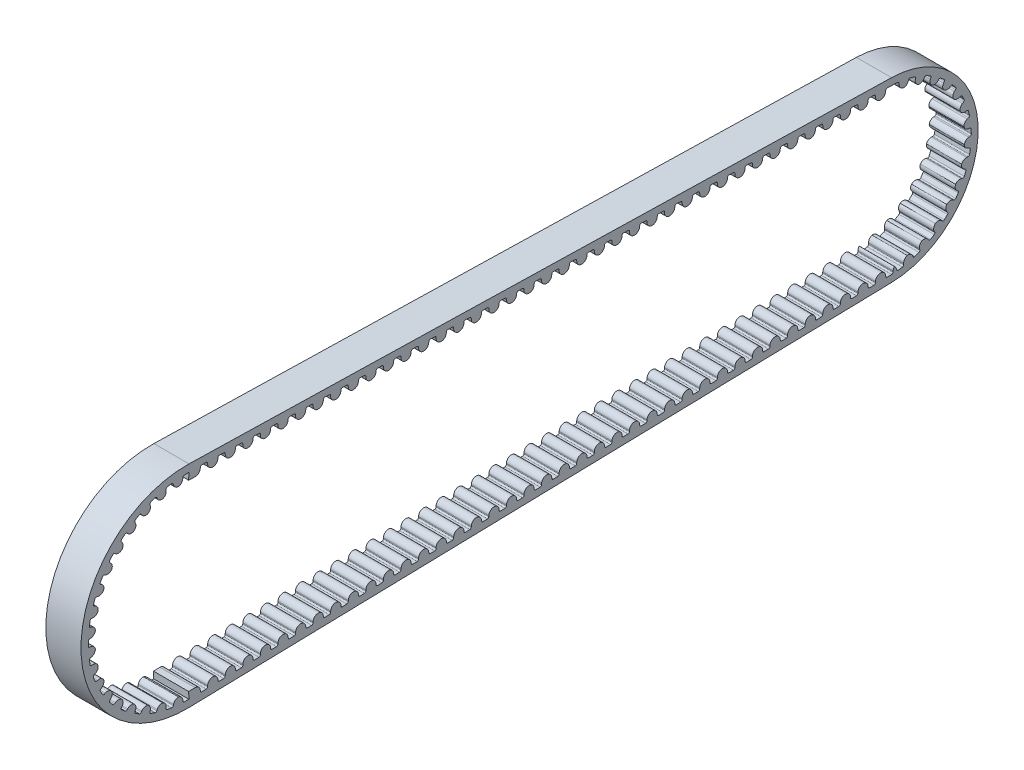
from build123d import *

# Parameters (mm, degrees)
SKETCH_2_W               = 6
SKETCH_2_H               = 2.4
CUT_EXTRUDE_1_DEPTH      = 137.430989504
PATTERN_CIRCULAR_1_COUNT = 36
CUT_EXTRUDE_2_DEPTH      = 137.430989504
PATTERN_CIRCULAR_2_COUNT = 30
SKETCH_11_W              = 6
SKETCH_11_H              = 119.925782778
EXTRUDE_11_DEPTH         = 2.4
CUT_EXTRUDE_3_REACH      = 138.431
PATTERN_LINEAR_1_COUNT   = 40
PATTERN_LINEAR_1_PITCH   = 3
MIRROR_1_COPY_1_REACH    = 138.431
MIRROR_1_COPY_2_REACH    = 138.431
MIRROR_1_COPY_3_REACH    = 138.431
MIRROR_1_COPY_4_REACH    = 138.431
MIRROR_1_COPY_5_REACH    = 138.431
MIRROR_1_COPY_6_REACH    = 138.431
MIRROR_1_COPY_7_REACH    = 138.431
MIRROR_1_COPY_8_REACH    = 138.431
MIRROR_1_COPY_9_REACH    = 138.431
MIRROR_1_COPY_10_REACH   = 138.431
MIRROR_1_COPY_11_REACH   = 138.431
MIRROR_1_COPY_12_REACH   = 138.431
MIRROR_1_COPY_13_REACH   = 138.431
MIRROR_1_COPY_14_REACH   = 138.431
MIRROR_1_COPY_15_REACH   = 138.431
MIRROR_1_COPY_16_REACH   = 138.431
MIRROR_1_COPY_17_REACH   = 138.431
MIRROR_1_COPY_18_REACH   = 138.431
MIRROR_1_COPY_19_REACH   = 138.431
MIRROR_1_COPY_20_REACH   = 138.431
MIRROR_1_COPY_21_REACH   = 138.431
MIRROR_1_COPY_22_REACH   = 138.431
MIRROR_1_COPY_23_REACH   = 138.431
MIRROR_1_COPY_24_REACH   = 138.431
MIRROR_1_COPY_25_REACH   = 138.431
MIRROR_1_COPY_26_REACH   = 138.431
MIRROR_1_COPY_27_REACH   = 138.431
MIRROR_1_COPY_28_REACH   = 138.431
MIRROR_1_COPY_29_REACH   = 138.431
MIRROR_1_COPY_30_REACH   = 138.431
MIRROR_1_COPY_31_REACH   = 138.431
MIRROR_1_COPY_32_REACH   = 138.431
MIRROR_1_COPY_33_REACH   = 138.431
MIRROR_1_COPY_34_REACH   = 138.431
MIRROR_1_COPY_35_REACH   = 138.431
MIRROR_1_COPY_36_REACH   = 138.431
MIRROR_1_COPY_37_REACH   = 138.431
MIRROR_1_COPY_38_REACH   = 138.431
MIRROR_1_COPY_39_REACH   = 138.431


with BuildPart() as part:
    # 扫描1: sweep along a path in 草图1
    with BuildLine(Plane(origin=(0, 0, 0), x_dir=(0, 0, -1), z_dir=(1, 0, 0))) as sweep_1_path:
        Line((0.430108244, 18.003863138), (120.321683561, 15.139680347))
        ThreePointArc((120.321683561, 15.139680347), (135.104, 0), (120.321683561, -15.139680347))
        Line((120.321683561, -15.139680347), (0.430108244, -18.003863138))
        ThreePointArc((0.430108244, -18.003863138), (-18.009, 0), (0.430108244, 18.003863138))
    # 草图2 → 扫描1 (sweep)
    with BuildSketch(Plane.XY):
        with Locations((0, 16.809)):
            Rectangle(SKETCH_2_W, SKETCH_2_H)
    sweep(path=sweep_1_path.line)

    # 草图3 → 切除-拉伸1 (cut, through all)
    with BuildSketch(Plane(origin=(3, 0, 0), x_dir=(0, 0, -1), z_dir=(1, 0, 0))):
        with BuildLine():
            Line((-16.760589295, -0.382514428), (-16.760589295, 0.382514428))
            ThreePointArc((-16.760589295, 0.382514428), (-16.694775482, 0.547617947), (-16.533429528, 0.622170699))
            Line((-16.533429528, 0.622170699), (-16.36404345, 0.631246016))
            ThreePointArc((-16.36404345, 0.631246016), (-15.779164365, 0.901499743), (-15.540589295, 1.5))
            Line((-15.540589295, 1.5), (-13.1201949, 1.5))
            Line((-13.1201949, 1.5), (-13.1201949, -1.5))
            Line((-13.1201949, -1.5), (-15.540589295, -1.5))
            ThreePointArc((-15.540589295, -1.5), (-15.779164365, -0.901499743), (-16.36404345, -0.631246016))
            Line((-16.36404345, -0.631246016), (-16.533429528, -0.622170699))
            ThreePointArc((-16.533429528, -0.622170699), (-16.694775482, -0.547617947), (-16.760589295, -0.382514428))
        make_face()
    cut_extrude_1 = extrude(amount=-CUT_EXTRUDE_1_DEPTH, mode=Mode.SUBTRACT)

    # 阵列(圆周)1: 切除-拉伸1 ×36 about axis
    pattern_circular_1_axis = Axis((0, 0, 0), (1, 0, 0))
    for i in range(1, PATTERN_CIRCULAR_1_COUNT):
        add(cut_extrude_1.rotate(pattern_circular_1_axis, i * 360 / PATTERN_CIRCULAR_1_COUNT), mode=Mode.SUBTRACT)

    # 草图4 → 切除-拉伸2 (cut, through all)
    with BuildSketch(Plane(origin=(3, 0, 0), x_dir=(0, 0, -1), z_dir=(1, 0, 0))):
        with BuildLine():
            Line((133.907660906, 0.770033285), (133.928868088, 0.030337229))
            ThreePointArc((133.928868088, 0.030337229), (133.872619042, -0.131045806), (133.723241537, -0.214080737))
            Line((133.723241537, -0.214080737), (133.487149373, -0.248146705))
            ThreePointArc((133.487149373, -0.248146705), (132.945655916, -0.549148333), (132.741753125, -1.134161833))
            ThreePointArc((132.741753125, -1.134161833), (132.458141229, -1.80210933), (131.766816708, -2.022699386))
            Line((131.766816708, -2.022699386), (131.74216386, -1.162820187))
            Line((131.74216386, -1.162820187), (131.656188797, 1.835947608))
            Line((131.656188797, 1.835947608), (131.631535949, 2.695826807))
            ThreePointArc((131.631535949, 2.695826807), (132.334363201, 2.515207264), (132.655778062, 1.864605962))
            ThreePointArc((132.655778062, 1.864605962), (132.892863198, 1.292235644), (133.450712533, 1.022752317))
            Line((133.450712533, 1.022752317), (133.688368638, 1.002268773))
            ThreePointArc((133.688368638, 1.002268773), (133.84225811, 0.927928545), (133.907660906, 0.770033285))
        make_face()
    cut_extrude_2 = extrude(amount=-CUT_EXTRUDE_2_DEPTH, mode=Mode.SUBTRACT)

    # 阵列(圆周)2: 切除-拉伸2 ×30 about axis
    pattern_circular_2_axis = Axis((0, 0, -119.96), (1, 0, 0))
    for i in range(1, PATTERN_CIRCULAR_2_COUNT):
        add(cut_extrude_2.rotate(pattern_circular_2_axis, i * 360 / PATTERN_CIRCULAR_2_COUNT), mode=Mode.SUBTRACT)

    # 草图11 → 拉伸11 (add)
    with BuildSketch(Plane(origin=(0, 18.003863138, -0.430108244), x_dir=(1, 0, 0), z_dir=(0, 0.9997147614067193, -0.023882960986995376))):
        with Locations((0, 59.962891389)):
            Rectangle(SKETCH_11_W, SKETCH_11_H)
    extrude_11 = extrude(amount=-EXTRUDE_11_DEPTH)

    # 镜向2: 拉伸11 across plane
    add(extrude_11.mirror(Plane.ZX))

    # 草图5 → 切除-拉伸3 (cut, up to next)
    with BuildSketch(Plane(origin=(3, 0, 0), x_dir=(0, 0, -1), z_dir=(1, 0, 0)), mode=Mode.PRIVATE) as cut_extrude_3_sk1:
        with BuildLine():
            Line((2.608225525, 16.771491728), (3.373036165, 16.753220574))
            ThreePointArc((3.373036165, 16.753220574), (3.536520761, 16.683482373), (3.607198829, 16.5204019))
            Line((3.607198829, 16.5204019), (3.612226117, 16.350847393))
            ThreePointArc((3.612226117, 16.350847393), (3.868434112, 15.759680678), (4.461065775, 15.506879701))
            Line((4.461065775, 15.506879701), (4.413299853, 13.507450178))
            Line((4.413299853, 13.507450178), (1.414155569, 13.579099061))
            Line((1.414155569, 13.579099061), (1.46192149, 15.578528584))
            ThreePointArc((1.46192149, 15.578528584), (2.065948911, 15.802741644), (2.350094196, 16.380999441))
            Line((2.350094196, 16.380999441), (2.363212365, 16.550120457))
            ThreePointArc((2.363212365, 16.550120457), (2.441597271, 16.709639849), (2.608225525, 16.771491728))
        make_face()
    cut_extrude_3_tool1 = extrude(cut_extrude_3_sk1.sketch, amount=-CUT_EXTRUDE_3_REACH, mode=Mode.PRIVATE) & part.part
    cut_extrude_3 = cut_extrude_3_tool1.solids().sort_by_distance((3, 14.90035, -2.946148))[0]
    add(cut_extrude_3, mode=Mode.SUBTRACT)

    # 阵列(线性)1: 切除-拉伸3 ×40
    with Locations(*[Vector(0, -0.02388296098699538, -0.9997147614067193) * (i * PATTERN_LINEAR_1_PITCH) for i in range(1, PATTERN_LINEAR_1_COUNT)]):
        add(cut_extrude_3, mode=Mode.SUBTRACT)

    # 镜向1: 切除-拉伸3 across plane
    add(cut_extrude_3.mirror(Plane.ZX), mode=Mode.SUBTRACT)

    # 镜向1 copy 1 sketch → 镜向1 copy 1 (cut, up to next)
    with BuildSketch(Plane(origin=(3, 0.071648883, -2.999144284), x_dir=(0, 0, -1), z_dir=(1, 0, 0)), mode=Mode.PRIVATE) as mirror_1_copy_1_sk1:
        with BuildLine():
            Line((2.608225525, -16.771491728), (3.373036165, -16.753220574))
            ThreePointArc((3.373036165, -16.753220574), (3.536520761, -16.683482373), (3.607198829, -16.5204019))
            Line((3.607198829, -16.5204019), (3.612226117, -16.350847393))
            ThreePointArc((3.612226117, -16.350847393), (3.868434112, -15.759680678), (4.461065775, -15.506879701))
            Line((4.461065775, -15.506879701), (4.413299853, -13.507450178))
            Line((4.413299853, -13.507450178), (1.414155569, -13.579099061))
            Line((1.414155569, -13.579099061), (1.46192149, -15.578528584))
            ThreePointArc((1.46192149, -15.578528584), (2.065948911, -15.802741644), (2.350094196, -16.380999441))
            Line((2.350094196, -16.380999441), (2.363212365, -16.550120457))
            ThreePointArc((2.363212365, -16.550120457), (2.441597271, -16.709639849), (2.608225525, -16.771491728))
        make_face()
    mirror_1_copy_1_tool1 = extrude(mirror_1_copy_1_sk1.sketch, amount=-MIRROR_1_COPY_1_REACH, mode=Mode.PRIVATE) & part.part
    add(mirror_1_copy_1_tool1.solids().sort_by_distance((3, -14.828701117, -5.945292284))[0], mode=Mode.SUBTRACT)

    # 镜向1 copy 2 sketch → 镜向1 copy 2 (cut, up to next)
    with BuildSketch(Plane(origin=(3, 0.143297766, -5.998288568), x_dir=(0, 0, -1), z_dir=(1, 0, 0)), mode=Mode.PRIVATE) as mirror_1_copy_2_sk1:
        with BuildLine():
            Line((2.608225525, -16.771491728), (3.373036165, -16.753220574))
            ThreePointArc((3.373036165, -16.753220574), (3.536520761, -16.683482373), (3.607198829, -16.5204019))
            Line((3.607198829, -16.5204019), (3.612226117, -16.350847393))
            ThreePointArc((3.612226117, -16.350847393), (3.868434112, -15.759680678), (4.461065775, -15.506879701))
            Line((4.461065775, -15.506879701), (4.413299853, -13.507450178))
            Line((4.413299853, -13.507450178), (1.414155569, -13.579099061))
            Line((1.414155569, -13.579099061), (1.46192149, -15.578528584))
            ThreePointArc((1.46192149, -15.578528584), (2.065948911, -15.802741644), (2.350094196, -16.380999441))
            Line((2.350094196, -16.380999441), (2.363212365, -16.550120457))
            ThreePointArc((2.363212365, -16.550120457), (2.441597271, -16.709639849), (2.608225525, -16.771491728))
        make_face()
    mirror_1_copy_2_tool1 = extrude(mirror_1_copy_2_sk1.sketch, amount=-MIRROR_1_COPY_2_REACH, mode=Mode.PRIVATE) & part.part
    add(mirror_1_copy_2_tool1.solids().sort_by_distance((3, -14.757052234, -8.944436568))[0], mode=Mode.SUBTRACT)

    # 镜向1 copy 3 sketch → 镜向1 copy 3 (cut, up to next)
    with BuildSketch(Plane(origin=(3, 0.214946649, -8.997432853), x_dir=(0, 0, -1), z_dir=(1, 0, 0)), mode=Mode.PRIVATE) as mirror_1_copy_3_sk1:
        with BuildLine():
            Line((2.608225525, -16.771491728), (3.373036165, -16.753220574))
            ThreePointArc((3.373036165, -16.753220574), (3.536520761, -16.683482373), (3.607198829, -16.5204019))
            Line((3.607198829, -16.5204019), (3.612226117, -16.350847393))
            ThreePointArc((3.612226117, -16.350847393), (3.868434112, -15.759680678), (4.461065775, -15.506879701))
            Line((4.461065775, -15.506879701), (4.413299853, -13.507450178))
            Line((4.413299853, -13.507450178), (1.414155569, -13.579099061))
            Line((1.414155569, -13.579099061), (1.46192149, -15.578528584))
            ThreePointArc((1.46192149, -15.578528584), (2.065948911, -15.802741644), (2.350094196, -16.380999441))
            Line((2.350094196, -16.380999441), (2.363212365, -16.550120457))
            ThreePointArc((2.363212365, -16.550120457), (2.441597271, -16.709639849), (2.608225525, -16.771491728))
        make_face()
    mirror_1_copy_3_tool1 = extrude(mirror_1_copy_3_sk1.sketch, amount=-MIRROR_1_COPY_3_REACH, mode=Mode.PRIVATE) & part.part
    add(mirror_1_copy_3_tool1.solids().sort_by_distance((3, -14.685403351, -11.943580853))[0], mode=Mode.SUBTRACT)

    # 镜向1 copy 4 sketch → 镜向1 copy 4 (cut, up to next)
    with BuildSketch(Plane(origin=(3, 0.286595532, -11.996577137), x_dir=(0, 0, -1), z_dir=(1, 0, 0)), mode=Mode.PRIVATE) as mirror_1_copy_4_sk1:
        with BuildLine():
            Line((2.608225525, -16.771491728), (3.373036165, -16.753220574))
            ThreePointArc((3.373036165, -16.753220574), (3.536520761, -16.683482373), (3.607198829, -16.5204019))
            Line((3.607198829, -16.5204019), (3.612226117, -16.350847393))
            ThreePointArc((3.612226117, -16.350847393), (3.868434112, -15.759680678), (4.461065775, -15.506879701))
            Line((4.461065775, -15.506879701), (4.413299853, -13.507450178))
            Line((4.413299853, -13.507450178), (1.414155569, -13.579099061))
            Line((1.414155569, -13.579099061), (1.46192149, -15.578528584))
            ThreePointArc((1.46192149, -15.578528584), (2.065948911, -15.802741644), (2.350094196, -16.380999441))
            Line((2.350094196, -16.380999441), (2.363212365, -16.550120457))
            ThreePointArc((2.363212365, -16.550120457), (2.441597271, -16.709639849), (2.608225525, -16.771491728))
        make_face()
    mirror_1_copy_4_tool1 = extrude(mirror_1_copy_4_sk1.sketch, amount=-MIRROR_1_COPY_4_REACH, mode=Mode.PRIVATE) & part.part
    add(mirror_1_copy_4_tool1.solids().sort_by_distance((3, -14.613754468, -14.942725137))[0], mode=Mode.SUBTRACT)

    # 镜向1 copy 5 sketch → 镜向1 copy 5 (cut, up to next)
    with BuildSketch(Plane(origin=(3, 0.358244415, -14.995721421), x_dir=(0, 0, -1), z_dir=(1, 0, 0)), mode=Mode.PRIVATE) as mirror_1_copy_5_sk1:
        with BuildLine():
            Line((2.608225525, -16.771491728), (3.373036165, -16.753220574))
            ThreePointArc((3.373036165, -16.753220574), (3.536520761, -16.683482373), (3.607198829, -16.5204019))
            Line((3.607198829, -16.5204019), (3.612226117, -16.350847393))
            ThreePointArc((3.612226117, -16.350847393), (3.868434112, -15.759680678), (4.461065775, -15.506879701))
            Line((4.461065775, -15.506879701), (4.413299853, -13.507450178))
            Line((4.413299853, -13.507450178), (1.414155569, -13.579099061))
            Line((1.414155569, -13.579099061), (1.46192149, -15.578528584))
            ThreePointArc((1.46192149, -15.578528584), (2.065948911, -15.802741644), (2.350094196, -16.380999441))
            Line((2.350094196, -16.380999441), (2.363212365, -16.550120457))
            ThreePointArc((2.363212365, -16.550120457), (2.441597271, -16.709639849), (2.608225525, -16.771491728))
        make_face()
    mirror_1_copy_5_tool1 = extrude(mirror_1_copy_5_sk1.sketch, amount=-MIRROR_1_COPY_5_REACH, mode=Mode.PRIVATE) & part.part
    add(mirror_1_copy_5_tool1.solids().sort_by_distance((3, -14.542105585, -17.941869421))[0], mode=Mode.SUBTRACT)

    # 镜向1 copy 6 sketch → 镜向1 copy 6 (cut, up to next)
    with BuildSketch(Plane(origin=(3, 0.429893298, -17.994865705), x_dir=(0, 0, -1), z_dir=(1, 0, 0)), mode=Mode.PRIVATE) as mirror_1_copy_6_sk1:
        with BuildLine():
            Line((2.608225525, -16.771491728), (3.373036165, -16.753220574))
            ThreePointArc((3.373036165, -16.753220574), (3.536520761, -16.683482373), (3.607198829, -16.5204019))
            Line((3.607198829, -16.5204019), (3.612226117, -16.350847393))
            ThreePointArc((3.612226117, -16.350847393), (3.868434112, -15.759680678), (4.461065775, -15.506879701))
            Line((4.461065775, -15.506879701), (4.413299853, -13.507450178))
            Line((4.413299853, -13.507450178), (1.414155569, -13.579099061))
            Line((1.414155569, -13.579099061), (1.46192149, -15.578528584))
            ThreePointArc((1.46192149, -15.578528584), (2.065948911, -15.802741644), (2.350094196, -16.380999441))
            Line((2.350094196, -16.380999441), (2.363212365, -16.550120457))
            ThreePointArc((2.363212365, -16.550120457), (2.441597271, -16.709639849), (2.608225525, -16.771491728))
        make_face()
    mirror_1_copy_6_tool1 = extrude(mirror_1_copy_6_sk1.sketch, amount=-MIRROR_1_COPY_6_REACH, mode=Mode.PRIVATE) & part.part
    add(mirror_1_copy_6_tool1.solids().sort_by_distance((3, -14.470456702, -20.941013705))[0], mode=Mode.SUBTRACT)

    # 镜向1 copy 7 sketch → 镜向1 copy 7 (cut, up to next)
    with BuildSketch(Plane(origin=(3, 0.501542181, -20.99400999), x_dir=(0, 0, -1), z_dir=(1, 0, 0)), mode=Mode.PRIVATE) as mirror_1_copy_7_sk1:
        with BuildLine():
            Line((2.608225525, -16.771491728), (3.373036165, -16.753220574))
            ThreePointArc((3.373036165, -16.753220574), (3.536520761, -16.683482373), (3.607198829, -16.5204019))
            Line((3.607198829, -16.5204019), (3.612226117, -16.350847393))
            ThreePointArc((3.612226117, -16.350847393), (3.868434112, -15.759680678), (4.461065775, -15.506879701))
            Line((4.461065775, -15.506879701), (4.413299853, -13.507450178))
            Line((4.413299853, -13.507450178), (1.414155569, -13.579099061))
            Line((1.414155569, -13.579099061), (1.46192149, -15.578528584))
            ThreePointArc((1.46192149, -15.578528584), (2.065948911, -15.802741644), (2.350094196, -16.380999441))
            Line((2.350094196, -16.380999441), (2.363212365, -16.550120457))
            ThreePointArc((2.363212365, -16.550120457), (2.441597271, -16.709639849), (2.608225525, -16.771491728))
        make_face()
    mirror_1_copy_7_tool1 = extrude(mirror_1_copy_7_sk1.sketch, amount=-MIRROR_1_COPY_7_REACH, mode=Mode.PRIVATE) & part.part
    add(mirror_1_copy_7_tool1.solids().sort_by_distance((3, -14.398807819, -23.94015799))[0], mode=Mode.SUBTRACT)

    # 镜向1 copy 8 sketch → 镜向1 copy 8 (cut, up to next)
    with BuildSketch(Plane(origin=(3, 0.573191064, -23.993154274), x_dir=(0, 0, -1), z_dir=(1, 0, 0)), mode=Mode.PRIVATE) as mirror_1_copy_8_sk1:
        with BuildLine():
            Line((2.608225525, -16.771491728), (3.373036165, -16.753220574))
            ThreePointArc((3.373036165, -16.753220574), (3.536520761, -16.683482373), (3.607198829, -16.5204019))
            Line((3.607198829, -16.5204019), (3.612226117, -16.350847393))
            ThreePointArc((3.612226117, -16.350847393), (3.868434112, -15.759680678), (4.461065775, -15.506879701))
            Line((4.461065775, -15.506879701), (4.413299853, -13.507450178))
            Line((4.413299853, -13.507450178), (1.414155569, -13.579099061))
            Line((1.414155569, -13.579099061), (1.46192149, -15.578528584))
            ThreePointArc((1.46192149, -15.578528584), (2.065948911, -15.802741644), (2.350094196, -16.380999441))
            Line((2.350094196, -16.380999441), (2.363212365, -16.550120457))
            ThreePointArc((2.363212365, -16.550120457), (2.441597271, -16.709639849), (2.608225525, -16.771491728))
        make_face()
    mirror_1_copy_8_tool1 = extrude(mirror_1_copy_8_sk1.sketch, amount=-MIRROR_1_COPY_8_REACH, mode=Mode.PRIVATE) & part.part
    add(mirror_1_copy_8_tool1.solids().sort_by_distance((3, -14.327158936, -26.939302274))[0], mode=Mode.SUBTRACT)

    # 镜向1 copy 9 sketch → 镜向1 copy 9 (cut, up to next)
    with BuildSketch(Plane(origin=(3, 0.644839947, -26.992298558), x_dir=(0, 0, -1), z_dir=(1, 0, 0)), mode=Mode.PRIVATE) as mirror_1_copy_9_sk1:
        with BuildLine():
            Line((2.608225525, -16.771491728), (3.373036165, -16.753220574))
            ThreePointArc((3.373036165, -16.753220574), (3.536520761, -16.683482373), (3.607198829, -16.5204019))
            Line((3.607198829, -16.5204019), (3.612226117, -16.350847393))
            ThreePointArc((3.612226117, -16.350847393), (3.868434112, -15.759680678), (4.461065775, -15.506879701))
            Line((4.461065775, -15.506879701), (4.413299853, -13.507450178))
            Line((4.413299853, -13.507450178), (1.414155569, -13.579099061))
            Line((1.414155569, -13.579099061), (1.46192149, -15.578528584))
            ThreePointArc((1.46192149, -15.578528584), (2.065948911, -15.802741644), (2.350094196, -16.380999441))
            Line((2.350094196, -16.380999441), (2.363212365, -16.550120457))
            ThreePointArc((2.363212365, -16.550120457), (2.441597271, -16.709639849), (2.608225525, -16.771491728))
        make_face()
    mirror_1_copy_9_tool1 = extrude(mirror_1_copy_9_sk1.sketch, amount=-MIRROR_1_COPY_9_REACH, mode=Mode.PRIVATE) & part.part
    add(mirror_1_copy_9_tool1.solids().sort_by_distance((3, -14.255510053, -29.938446558))[0], mode=Mode.SUBTRACT)

    # 镜向1 copy 10 sketch → 镜向1 copy 10 (cut, up to next)
    with BuildSketch(Plane(origin=(3, 0.71648883, -29.991442842), x_dir=(0, 0, -1), z_dir=(1, 0, 0)), mode=Mode.PRIVATE) as mirror_1_copy_10_sk1:
        with BuildLine():
            Line((2.608225525, -16.771491728), (3.373036165, -16.753220574))
            ThreePointArc((3.373036165, -16.753220574), (3.536520761, -16.683482373), (3.607198829, -16.5204019))
            Line((3.607198829, -16.5204019), (3.612226117, -16.350847393))
            ThreePointArc((3.612226117, -16.350847393), (3.868434112, -15.759680678), (4.461065775, -15.506879701))
            Line((4.461065775, -15.506879701), (4.413299853, -13.507450178))
            Line((4.413299853, -13.507450178), (1.414155569, -13.579099061))
            Line((1.414155569, -13.579099061), (1.46192149, -15.578528584))
            ThreePointArc((1.46192149, -15.578528584), (2.065948911, -15.802741644), (2.350094196, -16.380999441))
            Line((2.350094196, -16.380999441), (2.363212365, -16.550120457))
            ThreePointArc((2.363212365, -16.550120457), (2.441597271, -16.709639849), (2.608225525, -16.771491728))
        make_face()
    mirror_1_copy_10_tool1 = extrude(mirror_1_copy_10_sk1.sketch, amount=-MIRROR_1_COPY_10_REACH, mode=Mode.PRIVATE) & part.part
    add(mirror_1_copy_10_tool1.solids().sort_by_distance((3, -14.18386117, -32.937590842))[0], mode=Mode.SUBTRACT)

    # 镜向1 copy 11 sketch → 镜向1 copy 11 (cut, up to next)
    with BuildSketch(Plane(origin=(3, 0.788137713, -32.990587126), x_dir=(0, 0, -1), z_dir=(1, 0, 0)), mode=Mode.PRIVATE) as mirror_1_copy_11_sk1:
        with BuildLine():
            Line((2.608225525, -16.771491728), (3.373036165, -16.753220574))
            ThreePointArc((3.373036165, -16.753220574), (3.536520761, -16.683482373), (3.607198829, -16.5204019))
            Line((3.607198829, -16.5204019), (3.612226117, -16.350847393))
            ThreePointArc((3.612226117, -16.350847393), (3.868434112, -15.759680678), (4.461065775, -15.506879701))
            Line((4.461065775, -15.506879701), (4.413299853, -13.507450178))
            Line((4.413299853, -13.507450178), (1.414155569, -13.579099061))
            Line((1.414155569, -13.579099061), (1.46192149, -15.578528584))
            ThreePointArc((1.46192149, -15.578528584), (2.065948911, -15.802741644), (2.350094196, -16.380999441))
            Line((2.350094196, -16.380999441), (2.363212365, -16.550120457))
            ThreePointArc((2.363212365, -16.550120457), (2.441597271, -16.709639849), (2.608225525, -16.771491728))
        make_face()
    mirror_1_copy_11_tool1 = extrude(mirror_1_copy_11_sk1.sketch, amount=-MIRROR_1_COPY_11_REACH, mode=Mode.PRIVATE) & part.part
    add(mirror_1_copy_11_tool1.solids().sort_by_distance((3, -14.112212287, -35.936735126))[0], mode=Mode.SUBTRACT)

    # 镜向1 copy 12 sketch → 镜向1 copy 12 (cut, up to next)
    with BuildSketch(Plane(origin=(3, 0.859786596, -35.989731411), x_dir=(0, 0, -1), z_dir=(1, 0, 0)), mode=Mode.PRIVATE) as mirror_1_copy_12_sk1:
        with BuildLine():
            Line((2.608225525, -16.771491728), (3.373036165, -16.753220574))
            ThreePointArc((3.373036165, -16.753220574), (3.536520761, -16.683482373), (3.607198829, -16.5204019))
            Line((3.607198829, -16.5204019), (3.612226117, -16.350847393))
            ThreePointArc((3.612226117, -16.350847393), (3.868434112, -15.759680678), (4.461065775, -15.506879701))
            Line((4.461065775, -15.506879701), (4.413299853, -13.507450178))
            Line((4.413299853, -13.507450178), (1.414155569, -13.579099061))
            Line((1.414155569, -13.579099061), (1.46192149, -15.578528584))
            ThreePointArc((1.46192149, -15.578528584), (2.065948911, -15.802741644), (2.350094196, -16.380999441))
            Line((2.350094196, -16.380999441), (2.363212365, -16.550120457))
            ThreePointArc((2.363212365, -16.550120457), (2.441597271, -16.709639849), (2.608225525, -16.771491728))
        make_face()
    mirror_1_copy_12_tool1 = extrude(mirror_1_copy_12_sk1.sketch, amount=-MIRROR_1_COPY_12_REACH, mode=Mode.PRIVATE) & part.part
    add(mirror_1_copy_12_tool1.solids().sort_by_distance((3, -14.040563404, -38.935879411))[0], mode=Mode.SUBTRACT)

    # 镜向1 copy 13 sketch → 镜向1 copy 13 (cut, up to next)
    with BuildSketch(Plane(origin=(3, 0.931435478, -38.988875695), x_dir=(0, 0, -1), z_dir=(1, 0, 0)), mode=Mode.PRIVATE) as mirror_1_copy_13_sk1:
        with BuildLine():
            Line((2.608225525, -16.771491728), (3.373036165, -16.753220574))
            ThreePointArc((3.373036165, -16.753220574), (3.536520761, -16.683482373), (3.607198829, -16.5204019))
            Line((3.607198829, -16.5204019), (3.612226117, -16.350847393))
            ThreePointArc((3.612226117, -16.350847393), (3.868434112, -15.759680678), (4.461065775, -15.506879701))
            Line((4.461065775, -15.506879701), (4.413299853, -13.507450178))
            Line((4.413299853, -13.507450178), (1.414155569, -13.579099061))
            Line((1.414155569, -13.579099061), (1.46192149, -15.578528584))
            ThreePointArc((1.46192149, -15.578528584), (2.065948911, -15.802741644), (2.350094196, -16.380999441))
            Line((2.350094196, -16.380999441), (2.363212365, -16.550120457))
            ThreePointArc((2.363212365, -16.550120457), (2.441597271, -16.709639849), (2.608225525, -16.771491728))
        make_face()
    mirror_1_copy_13_tool1 = extrude(mirror_1_copy_13_sk1.sketch, amount=-MIRROR_1_COPY_13_REACH, mode=Mode.PRIVATE) & part.part
    add(mirror_1_copy_13_tool1.solids().sort_by_distance((3, -13.968914522, -41.935023695))[0], mode=Mode.SUBTRACT)

    # 镜向1 copy 14 sketch → 镜向1 copy 14 (cut, up to next)
    with BuildSketch(Plane(origin=(3, 1.003084361, -41.988019979), x_dir=(0, 0, -1), z_dir=(1, 0, 0)), mode=Mode.PRIVATE) as mirror_1_copy_14_sk1:
        with BuildLine():
            Line((2.608225525, -16.771491728), (3.373036165, -16.753220574))
            ThreePointArc((3.373036165, -16.753220574), (3.536520761, -16.683482373), (3.607198829, -16.5204019))
            Line((3.607198829, -16.5204019), (3.612226117, -16.350847393))
            ThreePointArc((3.612226117, -16.350847393), (3.868434112, -15.759680678), (4.461065775, -15.506879701))
            Line((4.461065775, -15.506879701), (4.413299853, -13.507450178))
            Line((4.413299853, -13.507450178), (1.414155569, -13.579099061))
            Line((1.414155569, -13.579099061), (1.46192149, -15.578528584))
            ThreePointArc((1.46192149, -15.578528584), (2.065948911, -15.802741644), (2.350094196, -16.380999441))
            Line((2.350094196, -16.380999441), (2.363212365, -16.550120457))
            ThreePointArc((2.363212365, -16.550120457), (2.441597271, -16.709639849), (2.608225525, -16.771491728))
        make_face()
    mirror_1_copy_14_tool1 = extrude(mirror_1_copy_14_sk1.sketch, amount=-MIRROR_1_COPY_14_REACH, mode=Mode.PRIVATE) & part.part
    add(mirror_1_copy_14_tool1.solids().sort_by_distance((3, -13.897265639, -44.934167979))[0], mode=Mode.SUBTRACT)

    # 镜向1 copy 15 sketch → 镜向1 copy 15 (cut, up to next)
    with BuildSketch(Plane(origin=(3, 1.074733244, -44.987164263), x_dir=(0, 0, -1), z_dir=(1, 0, 0)), mode=Mode.PRIVATE) as mirror_1_copy_15_sk1:
        with BuildLine():
            Line((2.608225525, -16.771491728), (3.373036165, -16.753220574))
            ThreePointArc((3.373036165, -16.753220574), (3.536520761, -16.683482373), (3.607198829, -16.5204019))
            Line((3.607198829, -16.5204019), (3.612226117, -16.350847393))
            ThreePointArc((3.612226117, -16.350847393), (3.868434112, -15.759680678), (4.461065775, -15.506879701))
            Line((4.461065775, -15.506879701), (4.413299853, -13.507450178))
            Line((4.413299853, -13.507450178), (1.414155569, -13.579099061))
            Line((1.414155569, -13.579099061), (1.46192149, -15.578528584))
            ThreePointArc((1.46192149, -15.578528584), (2.065948911, -15.802741644), (2.350094196, -16.380999441))
            Line((2.350094196, -16.380999441), (2.363212365, -16.550120457))
            ThreePointArc((2.363212365, -16.550120457), (2.441597271, -16.709639849), (2.608225525, -16.771491728))
        make_face()
    mirror_1_copy_15_tool1 = extrude(mirror_1_copy_15_sk1.sketch, amount=-MIRROR_1_COPY_15_REACH, mode=Mode.PRIVATE) & part.part
    add(mirror_1_copy_15_tool1.solids().sort_by_distance((3, -13.825616756, -47.933312263))[0], mode=Mode.SUBTRACT)

    # 镜向1 copy 16 sketch → 镜向1 copy 16 (cut, up to next)
    with BuildSketch(Plane(origin=(3, 1.146382127, -47.986308548), x_dir=(0, 0, -1), z_dir=(1, 0, 0)), mode=Mode.PRIVATE) as mirror_1_copy_16_sk1:
        with BuildLine():
            Line((2.608225525, -16.771491728), (3.373036165, -16.753220574))
            ThreePointArc((3.373036165, -16.753220574), (3.536520761, -16.683482373), (3.607198829, -16.5204019))
            Line((3.607198829, -16.5204019), (3.612226117, -16.350847393))
            ThreePointArc((3.612226117, -16.350847393), (3.868434112, -15.759680678), (4.461065775, -15.506879701))
            Line((4.461065775, -15.506879701), (4.413299853, -13.507450178))
            Line((4.413299853, -13.507450178), (1.414155569, -13.579099061))
            Line((1.414155569, -13.579099061), (1.46192149, -15.578528584))
            ThreePointArc((1.46192149, -15.578528584), (2.065948911, -15.802741644), (2.350094196, -16.380999441))
            Line((2.350094196, -16.380999441), (2.363212365, -16.550120457))
            ThreePointArc((2.363212365, -16.550120457), (2.441597271, -16.709639849), (2.608225525, -16.771491728))
        make_face()
    mirror_1_copy_16_tool1 = extrude(mirror_1_copy_16_sk1.sketch, amount=-MIRROR_1_COPY_16_REACH, mode=Mode.PRIVATE) & part.part
    add(mirror_1_copy_16_tool1.solids().sort_by_distance((3, -13.753967873, -50.932456548))[0], mode=Mode.SUBTRACT)

    # 镜向1 copy 17 sketch → 镜向1 copy 17 (cut, up to next)
    with BuildSketch(Plane(origin=(3, 1.21803101, -50.985452832), x_dir=(0, 0, -1), z_dir=(1, 0, 0)), mode=Mode.PRIVATE) as mirror_1_copy_17_sk1:
        with BuildLine():
            Line((2.608225525, -16.771491728), (3.373036165, -16.753220574))
            ThreePointArc((3.373036165, -16.753220574), (3.536520761, -16.683482373), (3.607198829, -16.5204019))
            Line((3.607198829, -16.5204019), (3.612226117, -16.350847393))
            ThreePointArc((3.612226117, -16.350847393), (3.868434112, -15.759680678), (4.461065775, -15.506879701))
            Line((4.461065775, -15.506879701), (4.413299853, -13.507450178))
            Line((4.413299853, -13.507450178), (1.414155569, -13.579099061))
            Line((1.414155569, -13.579099061), (1.46192149, -15.578528584))
            ThreePointArc((1.46192149, -15.578528584), (2.065948911, -15.802741644), (2.350094196, -16.380999441))
            Line((2.350094196, -16.380999441), (2.363212365, -16.550120457))
            ThreePointArc((2.363212365, -16.550120457), (2.441597271, -16.709639849), (2.608225525, -16.771491728))
        make_face()
    mirror_1_copy_17_tool1 = extrude(mirror_1_copy_17_sk1.sketch, amount=-MIRROR_1_COPY_17_REACH, mode=Mode.PRIVATE) & part.part
    add(mirror_1_copy_17_tool1.solids().sort_by_distance((3, -13.68231899, -53.931600832))[0], mode=Mode.SUBTRACT)

    # 镜向1 copy 18 sketch → 镜向1 copy 18 (cut, up to next)
    with BuildSketch(Plane(origin=(3, 1.289679893, -53.984597116), x_dir=(0, 0, -1), z_dir=(1, 0, 0)), mode=Mode.PRIVATE) as mirror_1_copy_18_sk1:
        with BuildLine():
            Line((2.608225525, -16.771491728), (3.373036165, -16.753220574))
            ThreePointArc((3.373036165, -16.753220574), (3.536520761, -16.683482373), (3.607198829, -16.5204019))
            Line((3.607198829, -16.5204019), (3.612226117, -16.350847393))
            ThreePointArc((3.612226117, -16.350847393), (3.868434112, -15.759680678), (4.461065775, -15.506879701))
            Line((4.461065775, -15.506879701), (4.413299853, -13.507450178))
            Line((4.413299853, -13.507450178), (1.414155569, -13.579099061))
            Line((1.414155569, -13.579099061), (1.46192149, -15.578528584))
            ThreePointArc((1.46192149, -15.578528584), (2.065948911, -15.802741644), (2.350094196, -16.380999441))
            Line((2.350094196, -16.380999441), (2.363212365, -16.550120457))
            ThreePointArc((2.363212365, -16.550120457), (2.441597271, -16.709639849), (2.608225525, -16.771491728))
        make_face()
    mirror_1_copy_18_tool1 = extrude(mirror_1_copy_18_sk1.sketch, amount=-MIRROR_1_COPY_18_REACH, mode=Mode.PRIVATE) & part.part
    add(mirror_1_copy_18_tool1.solids().sort_by_distance((3, -13.610670107, -56.930745116))[0], mode=Mode.SUBTRACT)

    # 镜向1 copy 19 sketch → 镜向1 copy 19 (cut, up to next)
    with BuildSketch(Plane(origin=(3, 1.361328776, -56.9837414), x_dir=(0, 0, -1), z_dir=(1, 0, 0)), mode=Mode.PRIVATE) as mirror_1_copy_19_sk1:
        with BuildLine():
            Line((2.608225525, -16.771491728), (3.373036165, -16.753220574))
            ThreePointArc((3.373036165, -16.753220574), (3.536520761, -16.683482373), (3.607198829, -16.5204019))
            Line((3.607198829, -16.5204019), (3.612226117, -16.350847393))
            ThreePointArc((3.612226117, -16.350847393), (3.868434112, -15.759680678), (4.461065775, -15.506879701))
            Line((4.461065775, -15.506879701), (4.413299853, -13.507450178))
            Line((4.413299853, -13.507450178), (1.414155569, -13.579099061))
            Line((1.414155569, -13.579099061), (1.46192149, -15.578528584))
            ThreePointArc((1.46192149, -15.578528584), (2.065948911, -15.802741644), (2.350094196, -16.380999441))
            Line((2.350094196, -16.380999441), (2.363212365, -16.550120457))
            ThreePointArc((2.363212365, -16.550120457), (2.441597271, -16.709639849), (2.608225525, -16.771491728))
        make_face()
    mirror_1_copy_19_tool1 = extrude(mirror_1_copy_19_sk1.sketch, amount=-MIRROR_1_COPY_19_REACH, mode=Mode.PRIVATE) & part.part
    add(mirror_1_copy_19_tool1.solids().sort_by_distance((3, -13.539021224, -59.9298894))[0], mode=Mode.SUBTRACT)

    # 镜向1 copy 20 sketch → 镜向1 copy 20 (cut, up to next)
    with BuildSketch(Plane(origin=(3, 1.432977659, -59.982885684), x_dir=(0, 0, -1), z_dir=(1, 0, 0)), mode=Mode.PRIVATE) as mirror_1_copy_20_sk1:
        with BuildLine():
            Line((2.608225525, -16.771491728), (3.373036165, -16.753220574))
            ThreePointArc((3.373036165, -16.753220574), (3.536520761, -16.683482373), (3.607198829, -16.5204019))
            Line((3.607198829, -16.5204019), (3.612226117, -16.350847393))
            ThreePointArc((3.612226117, -16.350847393), (3.868434112, -15.759680678), (4.461065775, -15.506879701))
            Line((4.461065775, -15.506879701), (4.413299853, -13.507450178))
            Line((4.413299853, -13.507450178), (1.414155569, -13.579099061))
            Line((1.414155569, -13.579099061), (1.46192149, -15.578528584))
            ThreePointArc((1.46192149, -15.578528584), (2.065948911, -15.802741644), (2.350094196, -16.380999441))
            Line((2.350094196, -16.380999441), (2.363212365, -16.550120457))
            ThreePointArc((2.363212365, -16.550120457), (2.441597271, -16.709639849), (2.608225525, -16.771491728))
        make_face()
    mirror_1_copy_20_tool1 = extrude(mirror_1_copy_20_sk1.sketch, amount=-MIRROR_1_COPY_20_REACH, mode=Mode.PRIVATE) & part.part
    add(mirror_1_copy_20_tool1.solids().sort_by_distance((3, -13.467372341, -62.929033684))[0], mode=Mode.SUBTRACT)

    # 镜向1 copy 21 sketch → 镜向1 copy 21 (cut, up to next)
    with BuildSketch(Plane(origin=(3, 1.504626542, -62.982029969), x_dir=(0, 0, -1), z_dir=(1, 0, 0)), mode=Mode.PRIVATE) as mirror_1_copy_21_sk1:
        with BuildLine():
            Line((2.608225525, -16.771491728), (3.373036165, -16.753220574))
            ThreePointArc((3.373036165, -16.753220574), (3.536520761, -16.683482373), (3.607198829, -16.5204019))
            Line((3.607198829, -16.5204019), (3.612226117, -16.350847393))
            ThreePointArc((3.612226117, -16.350847393), (3.868434112, -15.759680678), (4.461065775, -15.506879701))
            Line((4.461065775, -15.506879701), (4.413299853, -13.507450178))
            Line((4.413299853, -13.507450178), (1.414155569, -13.579099061))
            Line((1.414155569, -13.579099061), (1.46192149, -15.578528584))
            ThreePointArc((1.46192149, -15.578528584), (2.065948911, -15.802741644), (2.350094196, -16.380999441))
            Line((2.350094196, -16.380999441), (2.363212365, -16.550120457))
            ThreePointArc((2.363212365, -16.550120457), (2.441597271, -16.709639849), (2.608225525, -16.771491728))
        make_face()
    mirror_1_copy_21_tool1 = extrude(mirror_1_copy_21_sk1.sketch, amount=-MIRROR_1_COPY_21_REACH, mode=Mode.PRIVATE) & part.part
    add(mirror_1_copy_21_tool1.solids().sort_by_distance((3, -13.395723458, -65.928177969))[0], mode=Mode.SUBTRACT)

    # 镜向1 copy 22 sketch → 镜向1 copy 22 (cut, up to next)
    with BuildSketch(Plane(origin=(3, 1.576275425, -65.981174253), x_dir=(0, 0, -1), z_dir=(1, 0, 0)), mode=Mode.PRIVATE) as mirror_1_copy_22_sk1:
        with BuildLine():
            Line((2.608225525, -16.771491728), (3.373036165, -16.753220574))
            ThreePointArc((3.373036165, -16.753220574), (3.536520761, -16.683482373), (3.607198829, -16.5204019))
            Line((3.607198829, -16.5204019), (3.612226117, -16.350847393))
            ThreePointArc((3.612226117, -16.350847393), (3.868434112, -15.759680678), (4.461065775, -15.506879701))
            Line((4.461065775, -15.506879701), (4.413299853, -13.507450178))
            Line((4.413299853, -13.507450178), (1.414155569, -13.579099061))
            Line((1.414155569, -13.579099061), (1.46192149, -15.578528584))
            ThreePointArc((1.46192149, -15.578528584), (2.065948911, -15.802741644), (2.350094196, -16.380999441))
            Line((2.350094196, -16.380999441), (2.363212365, -16.550120457))
            ThreePointArc((2.363212365, -16.550120457), (2.441597271, -16.709639849), (2.608225525, -16.771491728))
        make_face()
    mirror_1_copy_22_tool1 = extrude(mirror_1_copy_22_sk1.sketch, amount=-MIRROR_1_COPY_22_REACH, mode=Mode.PRIVATE) & part.part
    add(mirror_1_copy_22_tool1.solids().sort_by_distance((3, -13.324074575, -68.927322253))[0], mode=Mode.SUBTRACT)

    # 镜向1 copy 23 sketch → 镜向1 copy 23 (cut, up to next)
    with BuildSketch(Plane(origin=(3, 1.647924308, -68.980318537), x_dir=(0, 0, -1), z_dir=(1, 0, 0)), mode=Mode.PRIVATE) as mirror_1_copy_23_sk1:
        with BuildLine():
            Line((2.608225525, -16.771491728), (3.373036165, -16.753220574))
            ThreePointArc((3.373036165, -16.753220574), (3.536520761, -16.683482373), (3.607198829, -16.5204019))
            Line((3.607198829, -16.5204019), (3.612226117, -16.350847393))
            ThreePointArc((3.612226117, -16.350847393), (3.868434112, -15.759680678), (4.461065775, -15.506879701))
            Line((4.461065775, -15.506879701), (4.413299853, -13.507450178))
            Line((4.413299853, -13.507450178), (1.414155569, -13.579099061))
            Line((1.414155569, -13.579099061), (1.46192149, -15.578528584))
            ThreePointArc((1.46192149, -15.578528584), (2.065948911, -15.802741644), (2.350094196, -16.380999441))
            Line((2.350094196, -16.380999441), (2.363212365, -16.550120457))
            ThreePointArc((2.363212365, -16.550120457), (2.441597271, -16.709639849), (2.608225525, -16.771491728))
        make_face()
    mirror_1_copy_23_tool1 = extrude(mirror_1_copy_23_sk1.sketch, amount=-MIRROR_1_COPY_23_REACH, mode=Mode.PRIVATE) & part.part
    add(mirror_1_copy_23_tool1.solids().sort_by_distance((3, -13.252425692, -71.926466537))[0], mode=Mode.SUBTRACT)

    # 镜向1 copy 24 sketch → 镜向1 copy 24 (cut, up to next)
    with BuildSketch(Plane(origin=(3, 1.719573191, -71.979462821), x_dir=(0, 0, -1), z_dir=(1, 0, 0)), mode=Mode.PRIVATE) as mirror_1_copy_24_sk1:
        with BuildLine():
            Line((2.608225525, -16.771491728), (3.373036165, -16.753220574))
            ThreePointArc((3.373036165, -16.753220574), (3.536520761, -16.683482373), (3.607198829, -16.5204019))
            Line((3.607198829, -16.5204019), (3.612226117, -16.350847393))
            ThreePointArc((3.612226117, -16.350847393), (3.868434112, -15.759680678), (4.461065775, -15.506879701))
            Line((4.461065775, -15.506879701), (4.413299853, -13.507450178))
            Line((4.413299853, -13.507450178), (1.414155569, -13.579099061))
            Line((1.414155569, -13.579099061), (1.46192149, -15.578528584))
            ThreePointArc((1.46192149, -15.578528584), (2.065948911, -15.802741644), (2.350094196, -16.380999441))
            Line((2.350094196, -16.380999441), (2.363212365, -16.550120457))
            ThreePointArc((2.363212365, -16.550120457), (2.441597271, -16.709639849), (2.608225525, -16.771491728))
        make_face()
    mirror_1_copy_24_tool1 = extrude(mirror_1_copy_24_sk1.sketch, amount=-MIRROR_1_COPY_24_REACH, mode=Mode.PRIVATE) & part.part
    add(mirror_1_copy_24_tool1.solids().sort_by_distance((3, -13.180776809, -74.925610821))[0], mode=Mode.SUBTRACT)

    # 镜向1 copy 25 sketch → 镜向1 copy 25 (cut, up to next)
    with BuildSketch(Plane(origin=(3, 1.791222074, -74.978607106), x_dir=(0, 0, -1), z_dir=(1, 0, 0)), mode=Mode.PRIVATE) as mirror_1_copy_25_sk1:
        with BuildLine():
            Line((2.608225525, -16.771491728), (3.373036165, -16.753220574))
            ThreePointArc((3.373036165, -16.753220574), (3.536520761, -16.683482373), (3.607198829, -16.5204019))
            Line((3.607198829, -16.5204019), (3.612226117, -16.350847393))
            ThreePointArc((3.612226117, -16.350847393), (3.868434112, -15.759680678), (4.461065775, -15.506879701))
            Line((4.461065775, -15.506879701), (4.413299853, -13.507450178))
            Line((4.413299853, -13.507450178), (1.414155569, -13.579099061))
            Line((1.414155569, -13.579099061), (1.46192149, -15.578528584))
            ThreePointArc((1.46192149, -15.578528584), (2.065948911, -15.802741644), (2.350094196, -16.380999441))
            Line((2.350094196, -16.380999441), (2.363212365, -16.550120457))
            ThreePointArc((2.363212365, -16.550120457), (2.441597271, -16.709639849), (2.608225525, -16.771491728))
        make_face()
    mirror_1_copy_25_tool1 = extrude(mirror_1_copy_25_sk1.sketch, amount=-MIRROR_1_COPY_25_REACH, mode=Mode.PRIVATE) & part.part
    add(mirror_1_copy_25_tool1.solids().sort_by_distance((3, -13.109127926, -77.924755106))[0], mode=Mode.SUBTRACT)

    # 镜向1 copy 26 sketch → 镜向1 copy 26 (cut, up to next)
    with BuildSketch(Plane(origin=(3, 1.862870957, -77.97775139), x_dir=(0, 0, -1), z_dir=(1, 0, 0)), mode=Mode.PRIVATE) as mirror_1_copy_26_sk1:
        with BuildLine():
            Line((2.608225525, -16.771491728), (3.373036165, -16.753220574))
            ThreePointArc((3.373036165, -16.753220574), (3.536520761, -16.683482373), (3.607198829, -16.5204019))
            Line((3.607198829, -16.5204019), (3.612226117, -16.350847393))
            ThreePointArc((3.612226117, -16.350847393), (3.868434112, -15.759680678), (4.461065775, -15.506879701))
            Line((4.461065775, -15.506879701), (4.413299853, -13.507450178))
            Line((4.413299853, -13.507450178), (1.414155569, -13.579099061))
            Line((1.414155569, -13.579099061), (1.46192149, -15.578528584))
            ThreePointArc((1.46192149, -15.578528584), (2.065948911, -15.802741644), (2.350094196, -16.380999441))
            Line((2.350094196, -16.380999441), (2.363212365, -16.550120457))
            ThreePointArc((2.363212365, -16.550120457), (2.441597271, -16.709639849), (2.608225525, -16.771491728))
        make_face()
    mirror_1_copy_26_tool1 = extrude(mirror_1_copy_26_sk1.sketch, amount=-MIRROR_1_COPY_26_REACH, mode=Mode.PRIVATE) & part.part
    add(mirror_1_copy_26_tool1.solids().sort_by_distance((3, -13.037479043, -80.92389939))[0], mode=Mode.SUBTRACT)

    # 镜向1 copy 27 sketch → 镜向1 copy 27 (cut, up to next)
    with BuildSketch(Plane(origin=(3, 1.93451984, -80.976895674), x_dir=(0, 0, -1), z_dir=(1, 0, 0)), mode=Mode.PRIVATE) as mirror_1_copy_27_sk1:
        with BuildLine():
            Line((2.608225525, -16.771491728), (3.373036165, -16.753220574))
            ThreePointArc((3.373036165, -16.753220574), (3.536520761, -16.683482373), (3.607198829, -16.5204019))
            Line((3.607198829, -16.5204019), (3.612226117, -16.350847393))
            ThreePointArc((3.612226117, -16.350847393), (3.868434112, -15.759680678), (4.461065775, -15.506879701))
            Line((4.461065775, -15.506879701), (4.413299853, -13.507450178))
            Line((4.413299853, -13.507450178), (1.414155569, -13.579099061))
            Line((1.414155569, -13.579099061), (1.46192149, -15.578528584))
            ThreePointArc((1.46192149, -15.578528584), (2.065948911, -15.802741644), (2.350094196, -16.380999441))
            Line((2.350094196, -16.380999441), (2.363212365, -16.550120457))
            ThreePointArc((2.363212365, -16.550120457), (2.441597271, -16.709639849), (2.608225525, -16.771491728))
        make_face()
    mirror_1_copy_27_tool1 = extrude(mirror_1_copy_27_sk1.sketch, amount=-MIRROR_1_COPY_27_REACH, mode=Mode.PRIVATE) & part.part
    add(mirror_1_copy_27_tool1.solids().sort_by_distance((3, -12.96583016, -83.923043674))[0], mode=Mode.SUBTRACT)

    # 镜向1 copy 28 sketch → 镜向1 copy 28 (cut, up to next)
    with BuildSketch(Plane(origin=(3, 2.006168723, -83.976039958), x_dir=(0, 0, -1), z_dir=(1, 0, 0)), mode=Mode.PRIVATE) as mirror_1_copy_28_sk1:
        with BuildLine():
            Line((2.608225525, -16.771491728), (3.373036165, -16.753220574))
            ThreePointArc((3.373036165, -16.753220574), (3.536520761, -16.683482373), (3.607198829, -16.5204019))
            Line((3.607198829, -16.5204019), (3.612226117, -16.350847393))
            ThreePointArc((3.612226117, -16.350847393), (3.868434112, -15.759680678), (4.461065775, -15.506879701))
            Line((4.461065775, -15.506879701), (4.413299853, -13.507450178))
            Line((4.413299853, -13.507450178), (1.414155569, -13.579099061))
            Line((1.414155569, -13.579099061), (1.46192149, -15.578528584))
            ThreePointArc((1.46192149, -15.578528584), (2.065948911, -15.802741644), (2.350094196, -16.380999441))
            Line((2.350094196, -16.380999441), (2.363212365, -16.550120457))
            ThreePointArc((2.363212365, -16.550120457), (2.441597271, -16.709639849), (2.608225525, -16.771491728))
        make_face()
    mirror_1_copy_28_tool1 = extrude(mirror_1_copy_28_sk1.sketch, amount=-MIRROR_1_COPY_28_REACH, mode=Mode.PRIVATE) & part.part
    add(mirror_1_copy_28_tool1.solids().sort_by_distance((3, -12.894181277, -86.922187958))[0], mode=Mode.SUBTRACT)

    # 镜向1 copy 29 sketch → 镜向1 copy 29 (cut, up to next)
    with BuildSketch(Plane(origin=(3, 2.077817606, -86.975184242), x_dir=(0, 0, -1), z_dir=(1, 0, 0)), mode=Mode.PRIVATE) as mirror_1_copy_29_sk1:
        with BuildLine():
            Line((2.608225525, -16.771491728), (3.373036165, -16.753220574))
            ThreePointArc((3.373036165, -16.753220574), (3.536520761, -16.683482373), (3.607198829, -16.5204019))
            Line((3.607198829, -16.5204019), (3.612226117, -16.350847393))
            ThreePointArc((3.612226117, -16.350847393), (3.868434112, -15.759680678), (4.461065775, -15.506879701))
            Line((4.461065775, -15.506879701), (4.413299853, -13.507450178))
            Line((4.413299853, -13.507450178), (1.414155569, -13.579099061))
            Line((1.414155569, -13.579099061), (1.46192149, -15.578528584))
            ThreePointArc((1.46192149, -15.578528584), (2.065948911, -15.802741644), (2.350094196, -16.380999441))
            Line((2.350094196, -16.380999441), (2.363212365, -16.550120457))
            ThreePointArc((2.363212365, -16.550120457), (2.441597271, -16.709639849), (2.608225525, -16.771491728))
        make_face()
    mirror_1_copy_29_tool1 = extrude(mirror_1_copy_29_sk1.sketch, amount=-MIRROR_1_COPY_29_REACH, mode=Mode.PRIVATE) & part.part
    add(mirror_1_copy_29_tool1.solids().sort_by_distance((3, -12.822532394, -89.921332242))[0], mode=Mode.SUBTRACT)

    # 镜向1 copy 30 sketch → 镜向1 copy 30 (cut, up to next)
    with BuildSketch(Plane(origin=(3, 2.149466489, -89.974328527), x_dir=(0, 0, -1), z_dir=(1, 0, 0)), mode=Mode.PRIVATE) as mirror_1_copy_30_sk1:
        with BuildLine():
            Line((2.608225525, -16.771491728), (3.373036165, -16.753220574))
            ThreePointArc((3.373036165, -16.753220574), (3.536520761, -16.683482373), (3.607198829, -16.5204019))
            Line((3.607198829, -16.5204019), (3.612226117, -16.350847393))
            ThreePointArc((3.612226117, -16.350847393), (3.868434112, -15.759680678), (4.461065775, -15.506879701))
            Line((4.461065775, -15.506879701), (4.413299853, -13.507450178))
            Line((4.413299853, -13.507450178), (1.414155569, -13.579099061))
            Line((1.414155569, -13.579099061), (1.46192149, -15.578528584))
            ThreePointArc((1.46192149, -15.578528584), (2.065948911, -15.802741644), (2.350094196, -16.380999441))
            Line((2.350094196, -16.380999441), (2.363212365, -16.550120457))
            ThreePointArc((2.363212365, -16.550120457), (2.441597271, -16.709639849), (2.608225525, -16.771491728))
        make_face()
    mirror_1_copy_30_tool1 = extrude(mirror_1_copy_30_sk1.sketch, amount=-MIRROR_1_COPY_30_REACH, mode=Mode.PRIVATE) & part.part
    add(mirror_1_copy_30_tool1.solids().sort_by_distance((3, -12.750883511, -92.920476527))[0], mode=Mode.SUBTRACT)

    # 镜向1 copy 31 sketch → 镜向1 copy 31 (cut, up to next)
    with BuildSketch(Plane(origin=(3, 2.221115372, -92.973472811), x_dir=(0, 0, -1), z_dir=(1, 0, 0)), mode=Mode.PRIVATE) as mirror_1_copy_31_sk1:
        with BuildLine():
            Line((2.608225525, -16.771491728), (3.373036165, -16.753220574))
            ThreePointArc((3.373036165, -16.753220574), (3.536520761, -16.683482373), (3.607198829, -16.5204019))
            Line((3.607198829, -16.5204019), (3.612226117, -16.350847393))
            ThreePointArc((3.612226117, -16.350847393), (3.868434112, -15.759680678), (4.461065775, -15.506879701))
            Line((4.461065775, -15.506879701), (4.413299853, -13.507450178))
            Line((4.413299853, -13.507450178), (1.414155569, -13.579099061))
            Line((1.414155569, -13.579099061), (1.46192149, -15.578528584))
            ThreePointArc((1.46192149, -15.578528584), (2.065948911, -15.802741644), (2.350094196, -16.380999441))
            Line((2.350094196, -16.380999441), (2.363212365, -16.550120457))
            ThreePointArc((2.363212365, -16.550120457), (2.441597271, -16.709639849), (2.608225525, -16.771491728))
        make_face()
    mirror_1_copy_31_tool1 = extrude(mirror_1_copy_31_sk1.sketch, amount=-MIRROR_1_COPY_31_REACH, mode=Mode.PRIVATE) & part.part
    add(mirror_1_copy_31_tool1.solids().sort_by_distance((3, -12.679234628, -95.919620811))[0], mode=Mode.SUBTRACT)

    # 镜向1 copy 32 sketch → 镜向1 copy 32 (cut, up to next)
    with BuildSketch(Plane(origin=(3, 2.292764255, -95.972617095), x_dir=(0, 0, -1), z_dir=(1, 0, 0)), mode=Mode.PRIVATE) as mirror_1_copy_32_sk1:
        with BuildLine():
            Line((2.608225525, -16.771491728), (3.373036165, -16.753220574))
            ThreePointArc((3.373036165, -16.753220574), (3.536520761, -16.683482373), (3.607198829, -16.5204019))
            Line((3.607198829, -16.5204019), (3.612226117, -16.350847393))
            ThreePointArc((3.612226117, -16.350847393), (3.868434112, -15.759680678), (4.461065775, -15.506879701))
            Line((4.461065775, -15.506879701), (4.413299853, -13.507450178))
            Line((4.413299853, -13.507450178), (1.414155569, -13.579099061))
            Line((1.414155569, -13.579099061), (1.46192149, -15.578528584))
            ThreePointArc((1.46192149, -15.578528584), (2.065948911, -15.802741644), (2.350094196, -16.380999441))
            Line((2.350094196, -16.380999441), (2.363212365, -16.550120457))
            ThreePointArc((2.363212365, -16.550120457), (2.441597271, -16.709639849), (2.608225525, -16.771491728))
        make_face()
    mirror_1_copy_32_tool1 = extrude(mirror_1_copy_32_sk1.sketch, amount=-MIRROR_1_COPY_32_REACH, mode=Mode.PRIVATE) & part.part
    add(mirror_1_copy_32_tool1.solids().sort_by_distance((3, -12.607585745, -98.918765095))[0], mode=Mode.SUBTRACT)

    # 镜向1 copy 33 sketch → 镜向1 copy 33 (cut, up to next)
    with BuildSketch(Plane(origin=(3, 2.364413138, -98.971761379), x_dir=(0, 0, -1), z_dir=(1, 0, 0)), mode=Mode.PRIVATE) as mirror_1_copy_33_sk1:
        with BuildLine():
            Line((2.608225525, -16.771491728), (3.373036165, -16.753220574))
            ThreePointArc((3.373036165, -16.753220574), (3.536520761, -16.683482373), (3.607198829, -16.5204019))
            Line((3.607198829, -16.5204019), (3.612226117, -16.350847393))
            ThreePointArc((3.612226117, -16.350847393), (3.868434112, -15.759680678), (4.461065775, -15.506879701))
            Line((4.461065775, -15.506879701), (4.413299853, -13.507450178))
            Line((4.413299853, -13.507450178), (1.414155569, -13.579099061))
            Line((1.414155569, -13.579099061), (1.46192149, -15.578528584))
            ThreePointArc((1.46192149, -15.578528584), (2.065948911, -15.802741644), (2.350094196, -16.380999441))
            Line((2.350094196, -16.380999441), (2.363212365, -16.550120457))
            ThreePointArc((2.363212365, -16.550120457), (2.441597271, -16.709639849), (2.608225525, -16.771491728))
        make_face()
    mirror_1_copy_33_tool1 = extrude(mirror_1_copy_33_sk1.sketch, amount=-MIRROR_1_COPY_33_REACH, mode=Mode.PRIVATE) & part.part
    add(mirror_1_copy_33_tool1.solids().sort_by_distance((3, -12.535936862, -101.917909379))[0], mode=Mode.SUBTRACT)

    # 镜向1 copy 34 sketch → 镜向1 copy 34 (cut, up to next)
    with BuildSketch(Plane(origin=(3, 2.436062021, -101.970905663), x_dir=(0, 0, -1), z_dir=(1, 0, 0)), mode=Mode.PRIVATE) as mirror_1_copy_34_sk1:
        with BuildLine():
            Line((2.608225525, -16.771491728), (3.373036165, -16.753220574))
            ThreePointArc((3.373036165, -16.753220574), (3.536520761, -16.683482373), (3.607198829, -16.5204019))
            Line((3.607198829, -16.5204019), (3.612226117, -16.350847393))
            ThreePointArc((3.612226117, -16.350847393), (3.868434112, -15.759680678), (4.461065775, -15.506879701))
            Line((4.461065775, -15.506879701), (4.413299853, -13.507450178))
            Line((4.413299853, -13.507450178), (1.414155569, -13.579099061))
            Line((1.414155569, -13.579099061), (1.46192149, -15.578528584))
            ThreePointArc((1.46192149, -15.578528584), (2.065948911, -15.802741644), (2.350094196, -16.380999441))
            Line((2.350094196, -16.380999441), (2.363212365, -16.550120457))
            ThreePointArc((2.363212365, -16.550120457), (2.441597271, -16.709639849), (2.608225525, -16.771491728))
        make_face()
    mirror_1_copy_34_tool1 = extrude(mirror_1_copy_34_sk1.sketch, amount=-MIRROR_1_COPY_34_REACH, mode=Mode.PRIVATE) & part.part
    add(mirror_1_copy_34_tool1.solids().sort_by_distance((3, -12.464287979, -104.917053663))[0], mode=Mode.SUBTRACT)

    # 镜向1 copy 35 sketch → 镜向1 copy 35 (cut, up to next)
    with BuildSketch(Plane(origin=(3, 2.507710904, -104.970049948), x_dir=(0, 0, -1), z_dir=(1, 0, 0)), mode=Mode.PRIVATE) as mirror_1_copy_35_sk1:
        with BuildLine():
            Line((2.608225525, -16.771491728), (3.373036165, -16.753220574))
            ThreePointArc((3.373036165, -16.753220574), (3.536520761, -16.683482373), (3.607198829, -16.5204019))
            Line((3.607198829, -16.5204019), (3.612226117, -16.350847393))
            ThreePointArc((3.612226117, -16.350847393), (3.868434112, -15.759680678), (4.461065775, -15.506879701))
            Line((4.461065775, -15.506879701), (4.413299853, -13.507450178))
            Line((4.413299853, -13.507450178), (1.414155569, -13.579099061))
            Line((1.414155569, -13.579099061), (1.46192149, -15.578528584))
            ThreePointArc((1.46192149, -15.578528584), (2.065948911, -15.802741644), (2.350094196, -16.380999441))
            Line((2.350094196, -16.380999441), (2.363212365, -16.550120457))
            ThreePointArc((2.363212365, -16.550120457), (2.441597271, -16.709639849), (2.608225525, -16.771491728))
        make_face()
    mirror_1_copy_35_tool1 = extrude(mirror_1_copy_35_sk1.sketch, amount=-MIRROR_1_COPY_35_REACH, mode=Mode.PRIVATE) & part.part
    add(mirror_1_copy_35_tool1.solids().sort_by_distance((3, -12.392639096, -107.916197948))[0], mode=Mode.SUBTRACT)

    # 镜向1 copy 36 sketch → 镜向1 copy 36 (cut, up to next)
    with BuildSketch(Plane(origin=(3, 2.579359787, -107.969194232), x_dir=(0, 0, -1), z_dir=(1, 0, 0)), mode=Mode.PRIVATE) as mirror_1_copy_36_sk1:
        with BuildLine():
            Line((2.608225525, -16.771491728), (3.373036165, -16.753220574))
            ThreePointArc((3.373036165, -16.753220574), (3.536520761, -16.683482373), (3.607198829, -16.5204019))
            Line((3.607198829, -16.5204019), (3.612226117, -16.350847393))
            ThreePointArc((3.612226117, -16.350847393), (3.868434112, -15.759680678), (4.461065775, -15.506879701))
            Line((4.461065775, -15.506879701), (4.413299853, -13.507450178))
            Line((4.413299853, -13.507450178), (1.414155569, -13.579099061))
            Line((1.414155569, -13.579099061), (1.46192149, -15.578528584))
            ThreePointArc((1.46192149, -15.578528584), (2.065948911, -15.802741644), (2.350094196, -16.380999441))
            Line((2.350094196, -16.380999441), (2.363212365, -16.550120457))
            ThreePointArc((2.363212365, -16.550120457), (2.441597271, -16.709639849), (2.608225525, -16.771491728))
        make_face()
    mirror_1_copy_36_tool1 = extrude(mirror_1_copy_36_sk1.sketch, amount=-MIRROR_1_COPY_36_REACH, mode=Mode.PRIVATE) & part.part
    add(mirror_1_copy_36_tool1.solids().sort_by_distance((3, -12.320990213, -110.915342232))[0], mode=Mode.SUBTRACT)

    # 镜向1 copy 37 sketch → 镜向1 copy 37 (cut, up to next)
    with BuildSketch(Plane(origin=(3, 2.65100867, -110.968338516), x_dir=(0, 0, -1), z_dir=(1, 0, 0)), mode=Mode.PRIVATE) as mirror_1_copy_37_sk1:
        with BuildLine():
            Line((2.608225525, -16.771491728), (3.373036165, -16.753220574))
            ThreePointArc((3.373036165, -16.753220574), (3.536520761, -16.683482373), (3.607198829, -16.5204019))
            Line((3.607198829, -16.5204019), (3.612226117, -16.350847393))
            ThreePointArc((3.612226117, -16.350847393), (3.868434112, -15.759680678), (4.461065775, -15.506879701))
            Line((4.461065775, -15.506879701), (4.413299853, -13.507450178))
            Line((4.413299853, -13.507450178), (1.414155569, -13.579099061))
            Line((1.414155569, -13.579099061), (1.46192149, -15.578528584))
            ThreePointArc((1.46192149, -15.578528584), (2.065948911, -15.802741644), (2.350094196, -16.380999441))
            Line((2.350094196, -16.380999441), (2.363212365, -16.550120457))
            ThreePointArc((2.363212365, -16.550120457), (2.441597271, -16.709639849), (2.608225525, -16.771491728))
        make_face()
    mirror_1_copy_37_tool1 = extrude(mirror_1_copy_37_sk1.sketch, amount=-MIRROR_1_COPY_37_REACH, mode=Mode.PRIVATE) & part.part
    add(mirror_1_copy_37_tool1.solids().sort_by_distance((3, -12.24934133, -113.914486516))[0], mode=Mode.SUBTRACT)

    # 镜向1 copy 38 sketch → 镜向1 copy 38 (cut, up to next)
    with BuildSketch(Plane(origin=(3, 2.722657553, -113.9674828), x_dir=(0, 0, -1), z_dir=(1, 0, 0)), mode=Mode.PRIVATE) as mirror_1_copy_38_sk1:
        with BuildLine():
            Line((2.608225525, -16.771491728), (3.373036165, -16.753220574))
            ThreePointArc((3.373036165, -16.753220574), (3.536520761, -16.683482373), (3.607198829, -16.5204019))
            Line((3.607198829, -16.5204019), (3.612226117, -16.350847393))
            ThreePointArc((3.612226117, -16.350847393), (3.868434112, -15.759680678), (4.461065775, -15.506879701))
            Line((4.461065775, -15.506879701), (4.413299853, -13.507450178))
            Line((4.413299853, -13.507450178), (1.414155569, -13.579099061))
            Line((1.414155569, -13.579099061), (1.46192149, -15.578528584))
            ThreePointArc((1.46192149, -15.578528584), (2.065948911, -15.802741644), (2.350094196, -16.380999441))
            Line((2.350094196, -16.380999441), (2.363212365, -16.550120457))
            ThreePointArc((2.363212365, -16.550120457), (2.441597271, -16.709639849), (2.608225525, -16.771491728))
        make_face()
    mirror_1_copy_38_tool1 = extrude(mirror_1_copy_38_sk1.sketch, amount=-MIRROR_1_COPY_38_REACH, mode=Mode.PRIVATE) & part.part
    add(mirror_1_copy_38_tool1.solids().sort_by_distance((3, -12.177692447, -116.9136308))[0], mode=Mode.SUBTRACT)

    # 镜向1 copy 39 sketch → 镜向1 copy 39 (cut, up to next)
    with BuildSketch(Plane(origin=(3, 2.794306435, -116.966627085), x_dir=(0, 0, -1), z_dir=(1, 0, 0)), mode=Mode.PRIVATE) as mirror_1_copy_39_sk1:
        with BuildLine():
            Line((2.608225525, -16.771491728), (3.373036165, -16.753220574))
            ThreePointArc((3.373036165, -16.753220574), (3.536520761, -16.683482373), (3.607198829, -16.5204019))
            Line((3.607198829, -16.5204019), (3.612226117, -16.350847393))
            ThreePointArc((3.612226117, -16.350847393), (3.868434112, -15.759680678), (4.461065775, -15.506879701))
            Line((4.461065775, -15.506879701), (4.413299853, -13.507450178))
            Line((4.413299853, -13.507450178), (1.414155569, -13.579099061))
            Line((1.414155569, -13.579099061), (1.46192149, -15.578528584))
            ThreePointArc((1.46192149, -15.578528584), (2.065948911, -15.802741644), (2.350094196, -16.380999441))
            Line((2.350094196, -16.380999441), (2.363212365, -16.550120457))
            ThreePointArc((2.363212365, -16.550120457), (2.441597271, -16.709639849), (2.608225525, -16.771491728))
        make_face()
    mirror_1_copy_39_tool1 = extrude(mirror_1_copy_39_sk1.sketch, amount=-MIRROR_1_COPY_39_REACH, mode=Mode.PRIVATE) & part.part
    add(mirror_1_copy_39_tool1.solids().sort_by_distance((3, -12.106043565, -119.912775085))[0], mode=Mode.SUBTRACT)


solid = part.part
